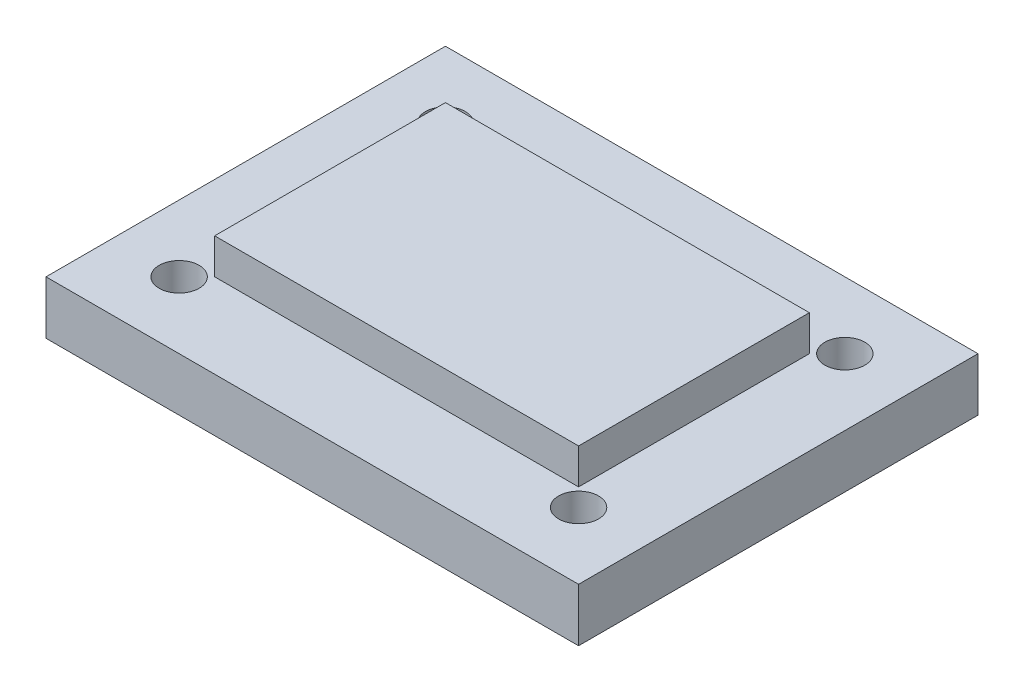
from build123d import *

# Parameters (mm, degrees)
F_01_BASE_PROFILE_W           = 120
F_01_BASE_PROFILE_H           = 90
F_01_BASE_PROFILE_R           = 4.5
F_01_BASE_PROFILE_W_2         = 18
F_01_BASE_PROFILE_H_2         = 51
F_01_BASE_EXTRUDE_DEPTH       = 12
F_02_BOSS_PROFILE_W           = 82
F_02_BOSS_PROFILE_H           = 52
F_02_REINFORCEMENT_BOSS_DEPTH = 20


with BuildPart() as part:
    # 01_Base_Profile → 01_Base_Extrude (new body)
    with BuildSketch(Plane(origin=(0, 0, 0), x_dir=(1, 0, 0), z_dir=(0, 1, 0))):
        Rectangle(F_01_BASE_PROFILE_W, F_01_BASE_PROFILE_H)
        with Locations((-45, -30)):
            Circle(F_01_BASE_PROFILE_R, mode=Mode.SUBTRACT)
        with Locations((45, -30)):
            Circle(F_01_BASE_PROFILE_R, mode=Mode.SUBTRACT)
        with Locations((-45, 30)):
            Circle(F_01_BASE_PROFILE_R, mode=Mode.SUBTRACT)
        with Locations((45, 30)):
            Circle(F_01_BASE_PROFILE_R, mode=Mode.SUBTRACT)
        Rectangle(F_01_BASE_PROFILE_W_2, F_01_BASE_PROFILE_H_2, mode=Mode.SUBTRACT)
    extrude(amount=F_01_BASE_EXTRUDE_DEPTH)

    # 02_Boss_Profile → 02_Reinforcement_Boss (add)
    with BuildSketch(Plane(origin=(0, 0, 0), x_dir=(1, 0, 0), z_dir=(0, 1, 0))):
        Rectangle(F_02_BOSS_PROFILE_W, F_02_BOSS_PROFILE_H)
    extrude(amount=F_02_REINFORCEMENT_BOSS_DEPTH)


solid = part.part
